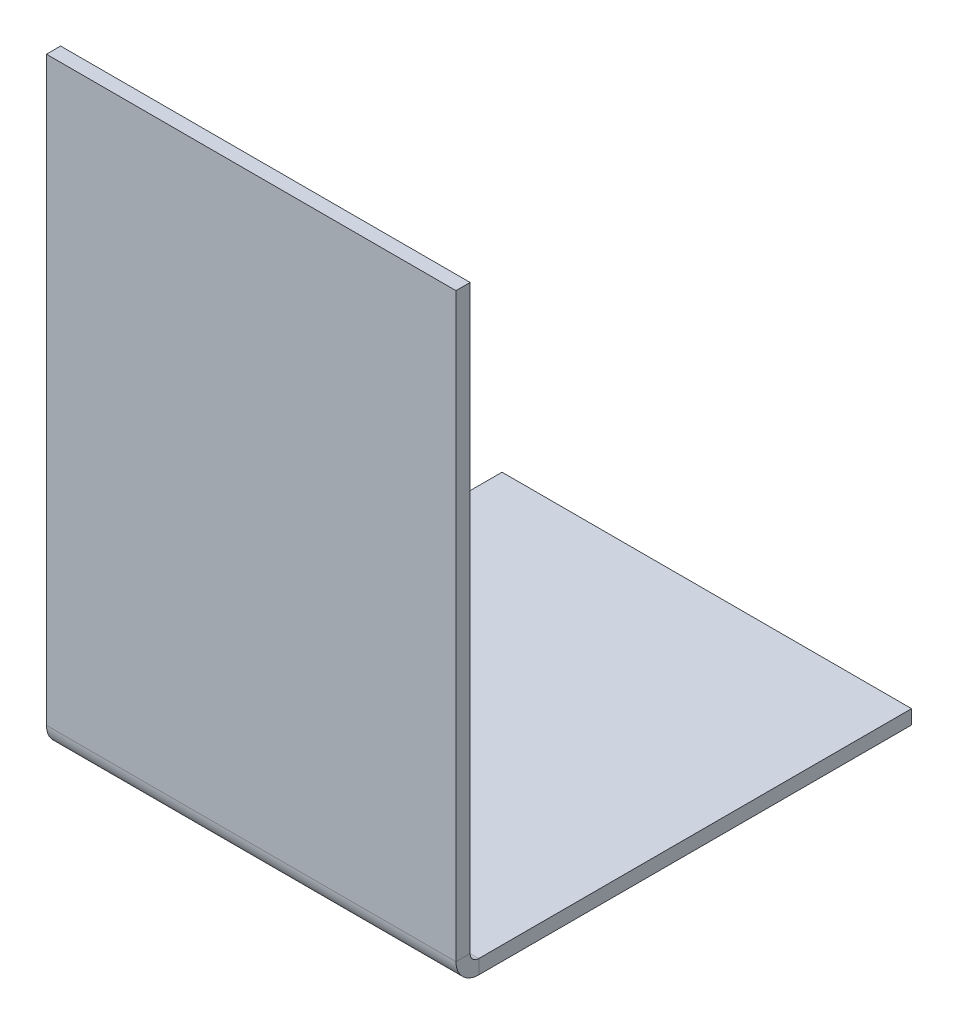
from build123d import *

# Parameters (mm, degrees)
SKETCH1_W              = 35.052
SKETCH1_H              = 88.9
BASE_FLANGE1_DEPTH     = 1.21412
SKETCHED_START         = -17.526
SKETCHED_BEND1_DEPTH   = 35.052
SKETCHED_BEND1_2_DEPTH = 35.052


# Read off the part's stored shape, not the designer's step: Sketched Bend1
# Sheet-metal steps are written as plain solids
with BuildPart() as part:
    # Sketch1 → Base-Flange1 (new body)
    with BuildSketch(Plane(origin=(0, 0, 0), x_dir=(1, 0, 0), z_dir=(0, 1, 0))):
        Rectangle(SKETCH1_W, SKETCH1_H)
    extrude(amount=-BASE_FLANGE1_DEPTH)

    # Sketched Bend1 outline → Sketched Bend1 (cut)
    with BuildSketch(Plane.YZ.offset(SKETCHED_START)):
        with BuildLine():
            ThreePointArc((-1.21412, -7.405308096), (-0.882382531, -6.317096681), (0, -5.599005531))
            Line((0, -5.599005531), (0, 44.45))
            Line((0, 44.45), (-1.21412, 44.45))
            Line((-1.21412, 44.45), (-1.21412, -7.405308096))
        make_face()
    extrude(amount=SKETCHED_BEND1_DEPTH, mode=Mode.SUBTRACT)

    # Sketched Bend1 2 outline → Sketched Bend1 2 (add)
    with BuildSketch(Plane.YZ.offset(SKETCHED_START)):
        with BuildLine():
            Line((50.481291904, -6.668708096), (50.481291904, -5.454588096))
            Line((50.481291904, -5.454588096), (0.7366, -5.454588096))
            ThreePointArc((0.7366, -5.454588096), (0.361288145, -5.491032899), (0, -5.599005531))
            Line((0, -5.599005531), (0, -7.405308096))
            ThreePointArc((0, -7.405308096), (0.215745145, -6.884453241), (0.7366, -6.668708096))
            Line((0.7366, -6.668708096), (50.481291904, -6.668708096))
        make_face()
    extrude(amount=SKETCHED_BEND1_2_DEPTH)


solid = part.part
